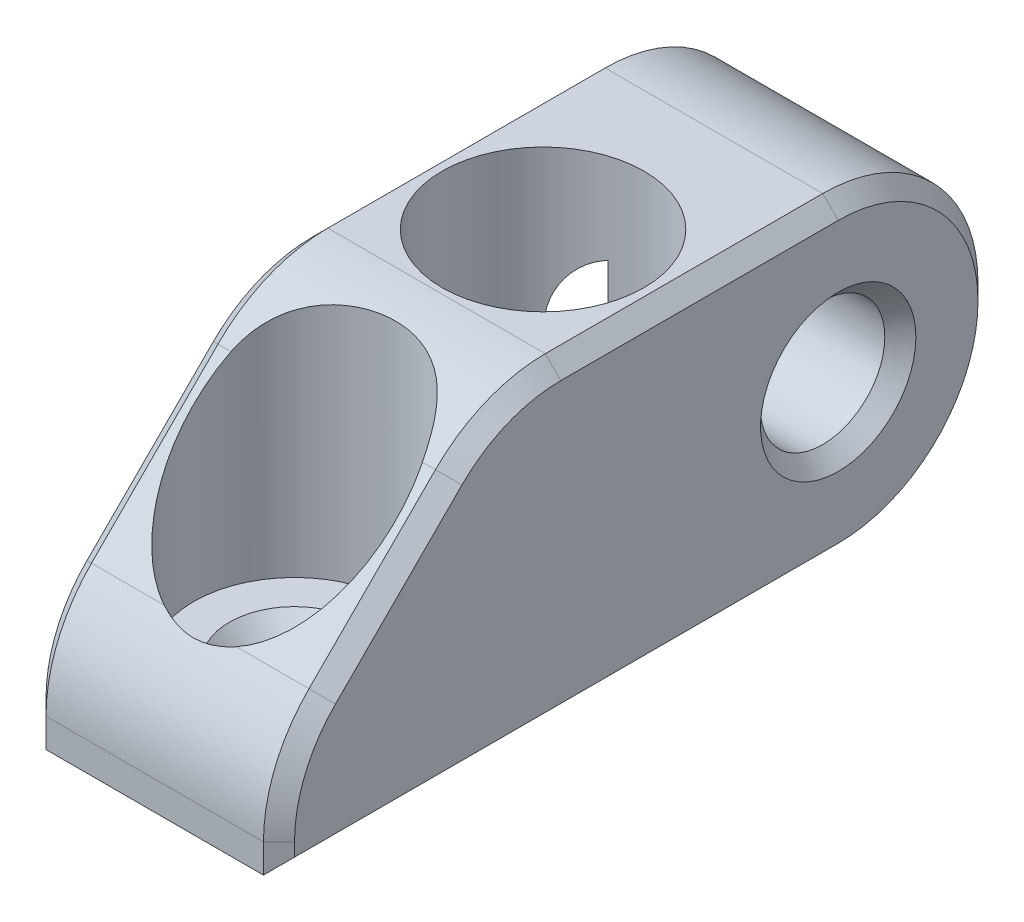
from build123d import *

# Parameters (mm, degrees)
SKETCH1_W           = 10.16
SKETCH1_H           = 29.21
SKETCH1_R           = 2.032
SKETCH1_R_2         = 4.1275
BOSS_EXTRUDE1_DEPTH = 12.7
SKETCH1_3_R         = 2.032
CUT_EXTRUDE2_DEPTH  = 21.010058096
CUT_EXTRUDE3_START  = 2.54
SKETCH1_4_R         = 4.1275
SKETCH1_4_R_2       = 2.032
CUT_EXTRUDE3_DEPTH  = 10.16
SKETCH2_R           = 4.05
CUT_EXTRUDE1_DEPTH  = 3.81
SKETCH3_R           = 2.54
CUT_EXTRUDE4_DEPTH  = 22.859131445
CHAMFER1_SIZE       = 8.89
FILLET1_R           = 6.35
FILLET2_R           = 6.35
CHAMFER2_SIZE       = 0.635


# Some blends are built 0.0001 mm under size
with BuildPart() as part:
    # Sketch1 → Boss-Extrude1 (new body)
    # profile 1 of 5: a face of its own
    with BuildSketch(Plane(origin=(0, 0, 0), x_dir=(1, 0, 0), z_dir=(0, 1, 0))):
        Rectangle(SKETCH1_W, SKETCH1_H)
        with Locations((0, -8.89)):
            Circle(SKETCH1_R, mode=Mode.SUBTRACT)
        with Locations((0, 1.27)):
            Circle(SKETCH1_R, mode=Mode.SUBTRACT)
    # profile 2 of 5: a face of its own
    with BuildSketch(Plane(origin=(0, 0, 0), x_dir=(1, 0, 0), z_dir=(0, 1, 0))):
        with Locations((0, 1.27)):
            Circle(SKETCH1_R_2)
        with Locations((0, 1.27)):
            Circle(SKETCH1_R, mode=Mode.SUBTRACT)
    # profile 3 of 5: a face of its own
    with BuildSketch(Plane(origin=(0, 0, 0), x_dir=(1, 0, 0), z_dir=(0, 1, 0))):
        with Locations((0, 1.27)):
            Circle(SKETCH1_R)
    # profile 4 of 5: a face of its own
    with BuildSketch(Plane(origin=(0, 0, 0), x_dir=(1, 0, 0), z_dir=(0, 1, 0))):
        with Locations((0, -8.89)):
            Circle(SKETCH1_R_2)
        with Locations((0, -8.89)):
            Circle(SKETCH1_R, mode=Mode.SUBTRACT)
    # profile 5 of 5: a face of its own
    with BuildSketch(Plane(origin=(0, 0, 0), x_dir=(1, 0, 0), z_dir=(0, 1, 0))):
        with Locations((0, -8.89)):
            Circle(SKETCH1_R)
    extrude(amount=BOSS_EXTRUDE1_DEPTH)

    # Sketch1<3> → Cut-Extrude2 (cut, through all)
    with BuildSketch(Plane(origin=(0, 0, 0), x_dir=(1, 0, 0), z_dir=(0, 1, 0))):
        with Locations(Location((0, 1.27, 0), (0, 0, 270))):
            Circle(SKETCH1_3_R)
        with Locations(Location((0, -8.89, 0), (0, 0, 270))):
            Circle(SKETCH1_3_R)
    extrude(amount=CUT_EXTRUDE2_DEPTH, mode=Mode.SUBTRACT)

    # Sketch1<4> → Cut-Extrude3 (cut)
    # profile 1 of 2: a face of its own
    with BuildSketch(Plane(origin=(0, 0, 0), x_dir=(1, 0, 0), z_dir=(0, 1, 0)).offset(CUT_EXTRUDE3_START)):
        with Locations(Location((0, -8.89, 0), (0, 0, 270))):
            Circle(SKETCH1_4_R)
        with Locations(Location((0, -8.89, 0), (0, 0, 270))):
            Circle(SKETCH1_4_R_2, mode=Mode.SUBTRACT)
    # profile 2 of 2: a face of its own
    with BuildSketch(Plane(origin=(0, 0, 0), x_dir=(1, 0, 0), z_dir=(0, 1, 0)).offset(CUT_EXTRUDE3_START)):
        with Locations(Location((0, 1.27, 0), (0, 0, 270))):
            Circle(SKETCH1_4_R)
        with Locations(Location((0, 1.27, 0), (0, 0, 270))):
            Circle(SKETCH1_4_R_2, mode=Mode.SUBTRACT)
    extrude(amount=CUT_EXTRUDE3_DEPTH, mode=Mode.SUBTRACT)

    # Sketch2 → Cut-Extrude1 (cut)
    with BuildSketch(Plane.ZY.offset(5.08)):
        with Locations((-8.255, 6.35)):
            Circle(SKETCH2_R)
    extrude(amount=-CUT_EXTRUDE1_DEPTH, mode=Mode.SUBTRACT)

    # Sketch3 → Cut-Extrude4 (cut, through all)
    with BuildSketch(Plane.ZY.offset(5.08)):
        with Locations((-8.255, 6.35)):
            Circle(SKETCH3_R)
    extrude(amount=-CUT_EXTRUDE4_DEPTH, mode=Mode.SUBTRACT)

    # Chamfer1
    # the kernel refuses this chamfer: 8.89 mm, written as the material it takes off along each edge
    with BuildSketch(Plane(origin=(-27.942261763, 12.7, 14.605), x_dir=(0, -0.9996219169112966, 0.027495876610586317), z_dir=(1, 0, 0))) as chamfer1_piece_1:
        Polygon((CHAMFER1_SIZE * 0.999621916911, CHAMFER1_SIZE * 0.0274958766106), (-CHAMFER1_SIZE * 0.0274958766106, CHAMFER1_SIZE * 0.999621916911), (0, 0), align=None)
    extrude(amount=55.884523526, mode=Mode.SUBTRACT)

    # Fillet1
    # the kernel refuses this fillet: 6.35 mm, written as the material it takes off along each edge
    with BuildSketch(Plane(origin=(-11.655640303, 3.81, 14.605), x_dir=(0, -1, 0), z_dir=(1, 0, 0))) as fillet1_piece_1:
        with BuildLine():
            CenterArc((FILLET1_R * 0.414213562373, FILLET1_R), FILLET1_R, 225, 45)
            Line((-FILLET1_R * 0.292893218814, FILLET1_R * 0.292893218814), (0, 0))
            Line((0, 0), (FILLET1_R * 0.414213562373, 0))
        make_face()
    extrude(amount=23.311280605, mode=Mode.SUBTRACT)
    with BuildSketch(Plane(origin=(-11.655640303, 12.7, 5.715), x_dir=(0, -0.7071067811862649, 0.7071067811868301), z_dir=(1, 0, 0)), Plane(origin=(-3.938287226, 12.7, 5.715), x_dir=(0, -0.7071067811862649, 0.7071067811868301), z_dir=(1, 0, 0))) as fillet1_piece_2:
        with BuildLine():
            CenterArc((FILLET1_R * 0.414213562373, FILLET1_R), FILLET1_R, 225, 45)
            Line((-FILLET1_R * 0.292893218813, FILLET1_R * 0.292893218813), (0, 0))
            Line((0, 0), (FILLET1_R * 0.414213562373, 0))
        make_face()
    extrude(amount=15.593927529, mode=Mode.SUBTRACT)

    # Fillet2
    fillet2_edges = [part.edges().sort_by_distance(p)[0] for p in [
        (0, 12.7, -14.605),
        (0, 0, -14.605),
    ]]
    fillet(fillet2_edges, radius=FILLET2_R - 0.0001)  # a hair under: the kernel refuses the full size

    # Chamfer2
    # the kernel refuses this chamfer: 0.635 mm, written as the material it takes off along each edge
    with BuildSketch(Plane(origin=(0, 0, -1.27), x_dir=(0, 0, 1), z_dir=(-1, 0, 0))) as chamfer2_piece_1:
        Polygon((2.032 + CHAMFER2_SIZE, 0), (2.032, CHAMFER2_SIZE), (2.032, 0), align=None)
    revolve(axis=Axis((0, 0, -1.27), (0, 1, 0)), mode=Mode.SUBTRACT)
    with BuildSketch(Plane(origin=(0, 0, 8.89), x_dir=(0, 0, 1), z_dir=(-1, 0, 0))) as chamfer2_piece_2:
        Polygon((2.032 + CHAMFER2_SIZE, 0), (2.032, CHAMFER2_SIZE), (2.032, 0), align=None)
    revolve(axis=Axis((0, 0, 8.89), (0, 1, 0)), mode=Mode.SUBTRACT)
    with BuildSketch(Plane(origin=(0, 2.54, 8.89), x_dir=(0, 0, 1), z_dir=(-1, 0, 0))) as chamfer2_piece_3:
        Polygon((2.032, -CHAMFER2_SIZE), (2.032 + CHAMFER2_SIZE, 0), (2.032, 0), align=None)
    revolve(axis=Axis((0, 2.54, 8.89), (0, 1, 0)), mode=Mode.SUBTRACT)
    with BuildSketch(Plane(origin=(0, 2.54, -1.27), x_dir=(0, 0, 1), z_dir=(-1, 0, 0))) as chamfer2_piece_4:
        Polygon((2.032, -CHAMFER2_SIZE), (2.032 + CHAMFER2_SIZE, 0), (2.032, 0), align=None)
    revolve(axis=Axis((0, 2.54, -1.27), (0, 1, 0)), mode=Mode.SUBTRACT)
    with BuildSketch(Plane(origin=(-5.08, 6.35, -8.255), x_dir=(0, 0, 1), z_dir=(0, -1, 0))) as chamfer2_piece_5:
        Polygon((4.05 + CHAMFER2_SIZE, 0), (4.05, -CHAMFER2_SIZE), (4.05, 0), align=None)
    revolve(axis=Axis((-5.08, 6.35, -8.255), (-1, 0, 0)), mode=Mode.SUBTRACT)
    with BuildSketch(Plane(origin=(-1.27, 6.35, -8.255), x_dir=(0, 0, 1), z_dir=(0, -1, 0))) as chamfer2_piece_6:
        Polygon((2.54 + CHAMFER2_SIZE, 0), (2.54, -CHAMFER2_SIZE), (2.54, 0), align=None)
    revolve(axis=Axis((-1.27, 6.35, -8.255), (-1, 0, 0)), mode=Mode.SUBTRACT)
    with BuildSketch(Plane(origin=(5.08, 6.35, -8.255), x_dir=(0, 0, 1), z_dir=(0, -1, 0))) as chamfer2_piece_7:
        Polygon((2.54 + CHAMFER2_SIZE, 0), (2.54, CHAMFER2_SIZE), (2.54, 0), align=None)
    revolve(axis=Axis((5.08, 6.35, -8.255), (-1, 0, 0)), mode=Mode.SUBTRACT)
    with BuildSketch(Plane(origin=(-5.08, 0, -8.2551), x_dir=(-0.027495876610585925, 0.9996219169112968, 0), z_dir=(0, 0, 1))) as chamfer2_piece_8:
        Polygon((CHAMFER2_SIZE * 0.999621916911, -CHAMFER2_SIZE * 0.0274958766106), (-CHAMFER2_SIZE * 0.0274958766106, -CHAMFER2_SIZE * 0.999621916911), (0, 0), align=None)
    extrude(amount=24.493118697, mode=Mode.SUBTRACT)
    with BuildSketch(Plane(origin=(5.08, -1.633018697, 14.605), x_dir=(-0.9996219169112966, 0, 0.027495876610587302), z_dir=(0, 1, 0)), Plane(origin=(-5.08, -1.633018697, 14.605), x_dir=(-0.027495876610585834, 0, -0.9996219169112968), z_dir=(0, 1, 0))) as chamfer2_piece_9:
        Polygon((CHAMFER2_SIZE * 0.999621916911, -CHAMFER2_SIZE * 0.0274958766106), (-CHAMFER2_SIZE * 0.0274958766106, -CHAMFER2_SIZE * 0.999621916911), (0, 0), align=None)
    extrude(amount=2.812762576, mode=Mode.SUBTRACT)
    with BuildSketch(Plane(origin=(-5.08, 10.840128061, 7.574871939), x_dir=(-0.027495876610587233, -0.706839436070956, -0.7068394360703909), z_dir=(0, -0.7071067811862648, 0.7071067811868302)), Plane(origin=(5.08, 5.669871939, 12.745128061), x_dir=(0.02749587661058726, -0.7068394360709561, -0.7068394360703909), z_dir=(0, 0.7071067811862648, -0.7071067811868302))) as chamfer2_piece_10:
        Polygon((CHAMFER2_SIZE * 0.999621916911, CHAMFER2_SIZE * 0.0274958766106), (-CHAMFER2_SIZE * 0.0274958766106, CHAMFER2_SIZE * 0.999621916911), (0, 0), align=None)
    extrude(amount=7.311846327, mode=Mode.SUBTRACT)
    with BuildSketch(Plane(origin=(-5.08, 12.7, -8.2551), x_dir=(-0.02749587661058591, -0.9996219169112968, 0), z_dir=(0, 0, 1))) as chamfer2_piece_11:
        Polygon((CHAMFER2_SIZE * 0.999621916911, CHAMFER2_SIZE * 0.0274958766106), (-CHAMFER2_SIZE * 0.0274958766106, CHAMFER2_SIZE * 0.999621916911), (0, 0), align=None)
    extrude(amount=11.339843879, mode=Mode.SUBTRACT)
    with BuildSketch(Plane(origin=(-5.08, 6.35, 3.084743879), x_dir=(0, 0.7071067811870476, 0.7071067811860474), z_dir=(0, -0.7071067811860474, 0.7071067811870476))) as chamfer2_piece_12:
        Polygon((6.35 - CHAMFER2_SIZE, 0), (6.35, -CHAMFER2_SIZE), (6.35, 0), align=None)
    revolve(axis=Axis((-5.08, 6.35, 3.084743879), (-1, 0, 0)), revolution_arc=45, mode=Mode.SUBTRACT)
    with BuildSketch(Plane(origin=(5.08, 0, 16.238018697), x_dir=(-0.9996219169112966, -0.0274958766105864, 0), z_dir=(0, 0, -1))) as chamfer2_piece_13:
        Polygon((CHAMFER2_SIZE * 0.999621916911, CHAMFER2_SIZE * 0.0274958766106), (-CHAMFER2_SIZE * 0.0274958766106, CHAMFER2_SIZE * 0.999621916911), (0, 0), align=None)
    extrude(amount=24.493118697, mode=Mode.SUBTRACT)
    with BuildSketch(Plane(origin=(-5.08, 1.179743879, 8.255), x_dir=(0, 0, 1), z_dir=(0, -1, 0))) as chamfer2_piece_14:
        Polygon((6.35 - CHAMFER2_SIZE, 0), (6.35, -CHAMFER2_SIZE), (6.35, 0), align=None)
    revolve(axis=Axis((-5.08, 1.179743879, 8.255), (-1, 0, 0)), revolution_arc=45, mode=Mode.SUBTRACT)
    with BuildSketch(Plane(origin=(5.08, 12.7, 3.084743879), x_dir=(-0.9996219169112966, 0.027495876610587302, 0), z_dir=(0, 0, -1))) as chamfer2_piece_15:
        Polygon((CHAMFER2_SIZE * 0.999621916911, -CHAMFER2_SIZE * 0.0274958766106), (-CHAMFER2_SIZE * 0.0274958766106, -CHAMFER2_SIZE * 0.999621916911), (0, 0), align=None)
    extrude(amount=11.339843879, mode=Mode.SUBTRACT)
    with BuildSketch(Plane(origin=(5.08, 6.35, 3.084743879), x_dir=(0, 0.7071067811870476, 0.7071067811860474), z_dir=(0, -0.7071067811860474, 0.7071067811870476))) as chamfer2_piece_16:
        Polygon((6.35, CHAMFER2_SIZE), (6.35 - CHAMFER2_SIZE, 0), (6.35, 0), align=None)
    revolve(axis=Axis((5.08, 6.35, 3.084743879), (-1, 0, 0)), revolution_arc=45, mode=Mode.SUBTRACT)
    with BuildSketch(Plane(origin=(5.08, 1.179743879, 8.255), x_dir=(0, 0, 1), z_dir=(0, -1, 0))) as chamfer2_piece_17:
        Polygon((6.35, CHAMFER2_SIZE), (6.35 - CHAMFER2_SIZE, 0), (6.35, 0), align=None)
    revolve(axis=Axis((5.08, 1.179743879, 8.255), (-1, 0, 0)), revolution_arc=45, mode=Mode.SUBTRACT)
    with BuildSketch(Plane(origin=(5.08, 6.3501, -8.2551), x_dir=(0, 0, -1), z_dir=(0, -1, 0))) as chamfer2_piece_18:
        Polygon((6.3499, -CHAMFER2_SIZE), (6.3499 - CHAMFER2_SIZE, 0), (6.3499, 0), align=None)
    revolve(axis=Axis((5.08, 6.3501, -8.2551), (1, 0, 0)), revolution_arc=90, mode=Mode.SUBTRACT)
    with BuildSketch(Plane(origin=(5.08, 6.3499, -8.2551), x_dir=(0, 0, -1), z_dir=(0, 1, 0))) as chamfer2_piece_19:
        Polygon((6.3499, CHAMFER2_SIZE), (6.3499 - CHAMFER2_SIZE, 0), (6.3499, 0), align=None)
    revolve(axis=Axis((5.08, 6.3499, -8.2551), (-1, 0, 0)), revolution_arc=90, mode=Mode.SUBTRACT)
    with BuildSketch(Plane(origin=(-5.08, 6.3501, -8.2551), x_dir=(0, 0, -1), z_dir=(0, -1, 0))) as chamfer2_piece_20:
        Polygon((6.3499 - CHAMFER2_SIZE, 0), (6.3499, CHAMFER2_SIZE), (6.3499, 0), align=None)
    revolve(axis=Axis((-5.08, 6.3501, -8.2551), (1, 0, 0)), revolution_arc=90, mode=Mode.SUBTRACT)
    with BuildSketch(Plane(origin=(-5.08, 6.3499, -8.2551), x_dir=(0, 0, -1), z_dir=(0, 1, 0))) as chamfer2_piece_21:
        Polygon((6.3499 - CHAMFER2_SIZE, 0), (6.3499, -CHAMFER2_SIZE), (6.3499, 0), align=None)
    revolve(axis=Axis((-5.08, 6.3499, -8.2551), (-1, 0, 0)), revolution_arc=90, mode=Mode.SUBTRACT)
    with BuildSketch(Plane(origin=(-5.08, 6.3499, -14.605), x_dir=(-0.02749587661058591, 0, 0.9996219169112968), z_dir=(0, 1, 0)), Plane(origin=(5.08, 6.3499, -14.605), x_dir=(-0.9996219169112966, 0, -0.027495876610587302), z_dir=(0, 1, 0))) as chamfer2_piece_22:
        Polygon((CHAMFER2_SIZE * 0.999621916911, CHAMFER2_SIZE * 0.0274958766106), (-CHAMFER2_SIZE * 0.0274958766106, CHAMFER2_SIZE * 0.999621916911), (0, 0), align=None)
    extrude(amount=0.0002, mode=Mode.SUBTRACT)


solid = part.part
